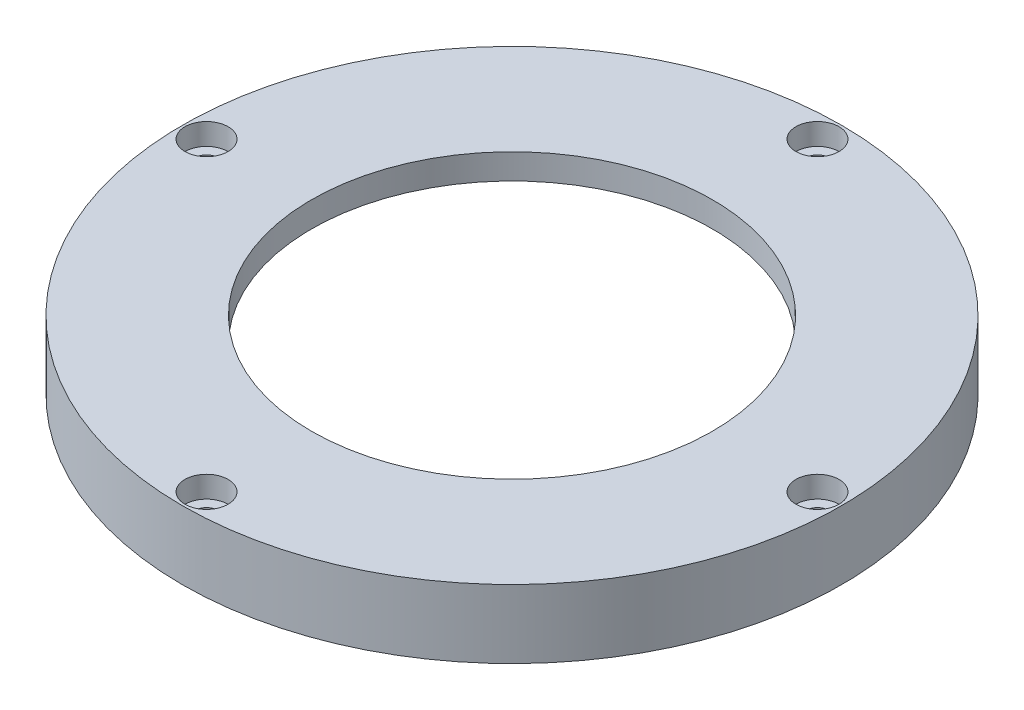
from build123d import *

# Parameters (mm, degrees)
SKETCH1_R           = 45.85
SKETCH1_R_2         = 1.5635
SKETCH1_R_3         = 39.3
BOSS_EXTRUDE1_DEPTH = 6
BOSS_EXTRUDE2_START = 3.525
SKETCH1_4_R         = 45.85
SKETCH1_4_R_2       = 1.5635
SKETCH1_4_R_3       = 27.9
BOSS_EXTRUDE2_DEPTH = 3.525
SKETCH2_R           = 3
CUT_EXTRUDE1_DEPTH  = 3


with BuildPart() as part:
    # Sketch1 → Boss-Extrude1 (new body)
    with BuildSketch(Plane(origin=(0, 0, 0), x_dir=(1, 0, 0), z_dir=(0, 1, 0))):
        Circle(SKETCH1_R)
        with Locations((0, -42.5)):
            Circle(SKETCH1_R_2, mode=Mode.SUBTRACT)
        with Locations((-42.5, 0)):
            Circle(SKETCH1_R_2, mode=Mode.SUBTRACT)
        Circle(SKETCH1_R_3, mode=Mode.SUBTRACT)
        with Locations((42.5, 0)):
            Circle(SKETCH1_R_2, mode=Mode.SUBTRACT)
        with Locations((0, 42.5)):
            Circle(SKETCH1_R_2, mode=Mode.SUBTRACT)
    extrude(amount=-BOSS_EXTRUDE1_DEPTH)

    # Sketch1<4> → Boss-Extrude2 (add)
    with BuildSketch(Plane(origin=(0, 0, 0), x_dir=(1, 0, 0), z_dir=(0, 1, 0)).offset(BOSS_EXTRUDE2_START)):
        Circle(SKETCH1_4_R)
        with Locations((0, -42.5)):
            Circle(SKETCH1_4_R_2, mode=Mode.SUBTRACT)
        with Locations((-42.5, 0)):
            Circle(SKETCH1_4_R_2, mode=Mode.SUBTRACT)
        with Locations((42.5, 0)):
            Circle(SKETCH1_4_R_2, mode=Mode.SUBTRACT)
        with Locations((0, 42.5)):
            Circle(SKETCH1_4_R_2, mode=Mode.SUBTRACT)
        Circle(SKETCH1_4_R_3, mode=Mode.SUBTRACT)
    extrude(amount=-BOSS_EXTRUDE2_DEPTH)

    # Sketch2 → Cut-Extrude1 (cut)
    with BuildSketch(Plane(origin=(0, 3.525, 0), x_dir=(1, 0, 0), z_dir=(0, 1, 0))):
        with Locations((42.5, 0)):
            Circle(SKETCH2_R)
        with Locations((0, -42.5)):
            Circle(SKETCH2_R)
        with Locations((-42.5, 0)):
            Circle(SKETCH2_R)
        with Locations((0, 42.5)):
            Circle(SKETCH2_R)
    extrude(amount=-CUT_EXTRUDE1_DEPTH, mode=Mode.SUBTRACT)


solid = part.part
